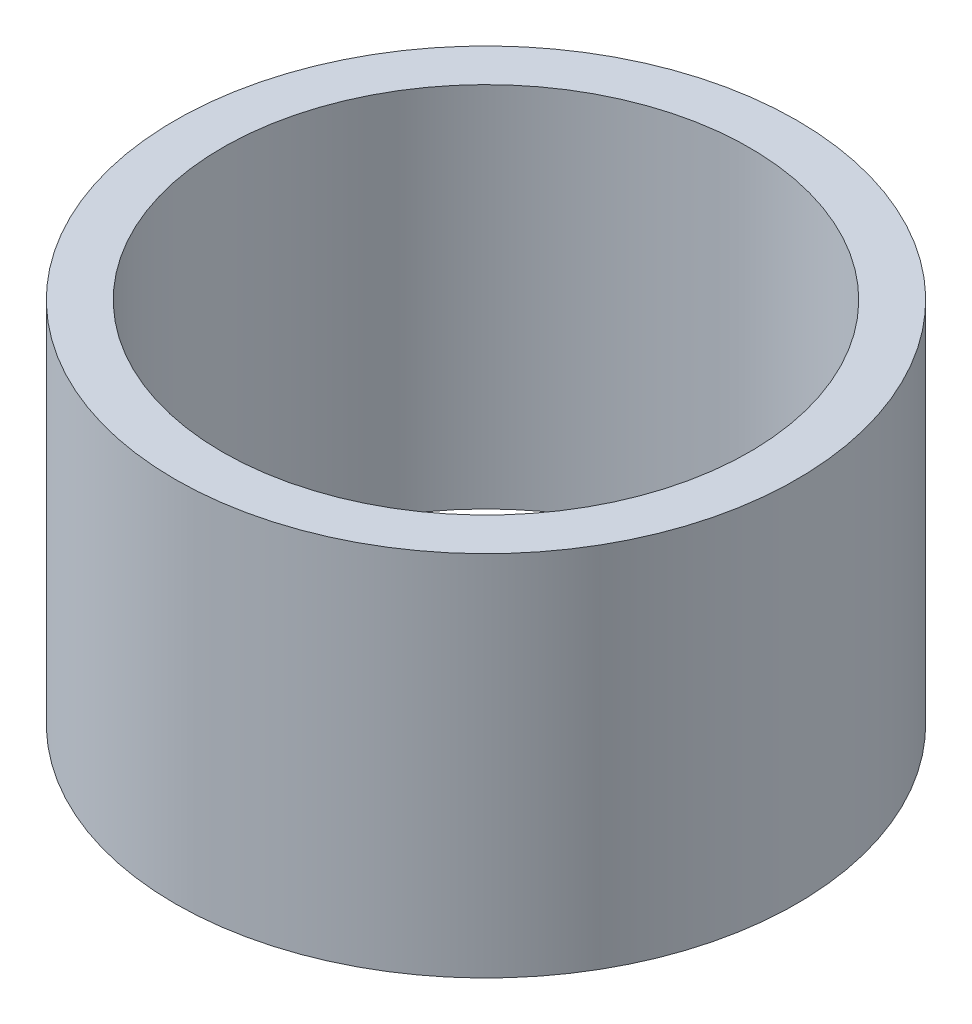
from build123d import *

# Parameters (mm, degrees)
SKETCH1_R           = 27.5
BOSS_EXTRUDE1_DEPTH = 32.504576119
SKETCH2_R           = 23.313830973
CUT_EXTRUDE1_DEPTH  = 51.685771857


with BuildPart() as part:
    # Sketch1 → Boss-Extrude1 (new body)
    with BuildSketch(Plane(origin=(0, 0, 0), x_dir=(1, 0, 0), z_dir=(0, 1, 0))):
        Circle(SKETCH1_R)
    extrude(amount=BOSS_EXTRUDE1_DEPTH)

    # Sketch2 → Cut-Extrude1 (cut, through all)
    with BuildSketch(Plane(origin=(0, 0, 0), x_dir=(1, 0, 0), z_dir=(0, 1, 0))):
        Circle(SKETCH2_R)
    extrude(amount=CUT_EXTRUDE1_DEPTH, mode=Mode.SUBTRACT)


solid = part.part
